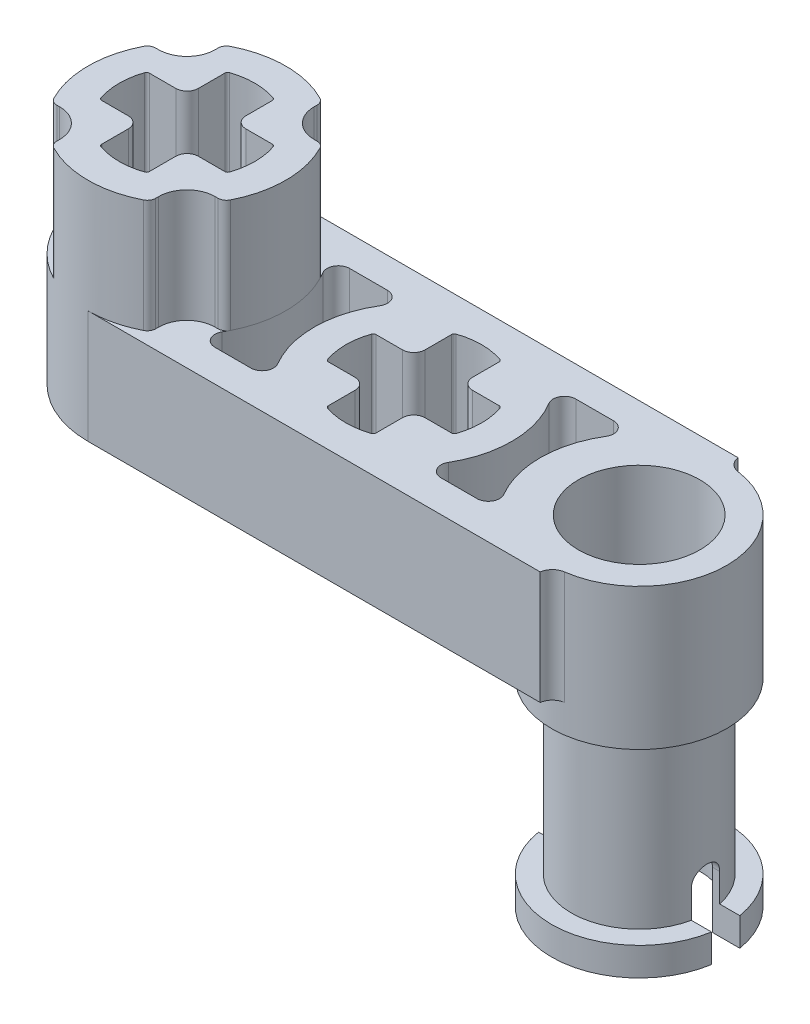
from build123d import *
from build123d.topology import SkipClean

# Parameters (mm, degrees)
BOSS_EXTRUDE1_DEPTH     = 2
BOSS_EXTRUDE3_START     = 4
BOSS_EXTRUDE3_DEPTH     = 4
CUT_EXTRUDE1_DEPTH      = 22.365860619
SKETCH8_R               = 2.15
CUT_EXTRUDE3_DEPTH      = 4
SKETCH10_R              = 3.1
BOSS_EXTRUDE4_DEPTH     = 1
SKETCH12_R              = 2.4
BOSS_EXTRUDE5_DEPTH     = 7
SKETCH15_R              = 3.1
BOSS_EXTRUDE6_DEPTH     = 1
SKETCH16_R              = 2.15
CUT_EXTRUDE4_DEPTH      = 22.365860619
CUT_EXTRUDE5_DEPTH      = 23.192341021
CUT_EXTRUDE5_DEPTH_BACK = 23.192341021
LPATTERN3_COUNT         = 2
LPATTERN3_PITCH         = 8.02
CUT_EXTRUDE6_DEPTH      = 24.162469696
LPATTERN4_COUNT         = 2
LPATTERN4_PITCH         = 8
CUT_EXTRUDE7_DEPTH      = 24.162469696
FILLET2_R               = 0.5
FILLET3_R               = 0.5


with BuildPart() as part:
    # Sketch2 → Boss-Extrude1 (new, symmetric)
    with BuildSketch(Plane(origin=(0, 0, 0), x_dir=(1, 0, 0), z_dir=(0, 1, 0))):
        with BuildLine():
            Line((0, 3.5), (16, 3.5))
            ThreePointArc((16, 3.5), (19.5, 0), (16, -3.5))
            Line((16, -3.5), (0, -3.5))
            ThreePointArc((0, -3.5), (-3.5, 0), (0, 3.5))
        make_face()
    extrude(amount=BOSS_EXTRUDE1_DEPTH, both=True)

    # Sketch3 → Boss-Extrude3 (add)
    with SkipClean():  # the faces are left unmerged after this step: merging them gives an invalid solid
        with BuildSketch(Plane(origin=(0, 2, 0), x_dir=(1, 0, 0), z_dir=(0, 1, 0)).offset(BOSS_EXTRUDE3_START)):
            with BuildLine():
                Line((1.75, 2.75), (1.75, 2.852630365))
                ThreePointArc((1.75, 2.852630365), (1.705715907, 3.00950412), (1.5859375, 3.120064462))
                ThreePointArc((1.5859375, 3.120064462), (0, 3.5), (-1.5859375, 3.120064462))
                ThreePointArc((-1.5859375, 3.120064462), (-1.705715907, 3.00950412), (-1.75, 2.852630365))
                Line((-1.75, 2.852630365), (-1.75, 2.75))
                ThreePointArc((-1.75, 2.75), (-2.042893219, 2.042893219), (-2.75, 1.75))
                Line((-2.75, 1.75), (-2.852630365, 1.75))
                ThreePointArc((-2.852630365, 1.75), (-3.00950412, 1.705715907), (-3.120064462, 1.5859375))
                ThreePointArc((-3.120064462, 1.5859375), (-3.5, 0), (-3.120064462, -1.5859375))
                ThreePointArc((-3.120064462, -1.5859375), (-3.00950412, -1.705715907), (-2.852630365, -1.75))
                Line((-2.852630365, -1.75), (-2.75, -1.75))
                ThreePointArc((-2.75, -1.75), (-2.042893219, -2.042893219), (-1.75, -2.75))
                Line((-1.75, -2.75), (-1.75, -2.852630365))
                ThreePointArc((-1.75, -2.852630365), (-1.705715907, -3.00950412), (-1.5859375, -3.120064462))
                ThreePointArc((-1.5859375, -3.120064462), (0, -3.5), (1.5859375, -3.120064462))
                ThreePointArc((1.5859375, -3.120064462), (1.705715907, -3.00950412), (1.75, -2.852630365))
                Line((1.75, -2.852630365), (1.75, -2.75))
                ThreePointArc((1.75, -2.75), (2.042893219, -2.042893219), (2.75, -1.75))
                Line((2.75, -1.75), (2.852630365, -1.75))
                ThreePointArc((2.852630365, -1.75), (3.00950412, -1.705715907), (3.120064462, -1.5859375))
                ThreePointArc((3.120064462, -1.5859375), (3.5, 0), (3.120064462, 1.5859375))
                ThreePointArc((3.120064462, 1.5859375), (3.00950412, 1.705715907), (2.852630365, 1.75))
                Line((2.852630365, 1.75), (2.75, 1.75))
                ThreePointArc((2.75, 1.75), (2.042893219, 2.042893219), (1.75, 2.75))
            make_face()
        extrude(amount=-BOSS_EXTRUDE3_DEPTH)

    # Sketch4 → Cut-Extrude1 (cut, through all)
    with SkipClean():  # the faces are left unmerged after this step: merging them gives an invalid solid
        with BuildSketch(Plane(origin=(0, 6, 0), x_dir=(1, 0, 0), z_dir=(0, 1, 0))):
            with BuildLine():
                Line((-0.861545414, -1.212506528), (-0.861545414, -2.150211742))
                ThreePointArc((-0.861545414, -2.150211742), (-0.842839298, -2.208446649), (-0.793719327, -2.244894577))
                ThreePointArc((-0.793719327, -2.244894577), (-0.021545414, -2.372506528), (0.750628499, -2.244894577))
                ThreePointArc((0.750628499, -2.244894577), (0.799748471, -2.208446649), (0.818454586, -2.150211742))
                Line((0.818454586, -2.150211742), (0.818454586, -1.212506528))
                ThreePointArc((0.818454586, -1.212506528), (0.935611874, -0.929663815), (1.218454586, -0.812506528))
                Line((1.218454586, -0.812506528), (2.156159801, -0.812506528))
                ThreePointArc((2.156159801, -0.812506528), (2.214394707, -0.793800412), (2.250842636, -0.744680441))
                ThreePointArc((2.250842636, -0.744680441), (2.378454586, 0.027493472), (2.250842636, 0.799667385))
                ThreePointArc((2.250842636, 0.799667385), (2.214394707, 0.848787357), (2.156159801, 0.867493472))
                Line((2.156159801, 0.867493472), (1.218454586, 0.867493472))
                ThreePointArc((1.218454586, 0.867493472), (0.935611874, 0.98465076), (0.818454586, 1.267493472))
                Line((0.818454586, 1.267493472), (0.818454586, 2.205198686))
                ThreePointArc((0.818454586, 2.205198686), (0.799748471, 2.263433593), (0.750628499, 2.299881522))
                ThreePointArc((0.750628499, 2.299881522), (-0.021545414, 2.427493472), (-0.793719327, 2.299881522))
                ThreePointArc((-0.793719327, 2.299881522), (-0.842839298, 2.263433593), (-0.861545414, 2.205198686))
                Line((-0.861545414, 2.205198686), (-0.861545414, 1.267493472))
                ThreePointArc((-0.861545414, 1.267493472), (-0.978702701, 0.98465076), (-1.261545414, 0.867493472))
                Line((-1.261545414, 0.867493472), (-2.199250628, 0.867493472))
                ThreePointArc((-2.199250628, 0.867493472), (-2.257485535, 0.848787357), (-2.293933463, 0.799667385))
                ThreePointArc((-2.293933463, 0.799667385), (-2.421545414, 0.027493472), (-2.293933463, -0.744680441))
                ThreePointArc((-2.293933463, -0.744680441), (-2.257485535, -0.793800412), (-2.199250628, -0.812506528))
                Line((-2.199250628, -0.812506528), (-1.261545414, -0.812506528))
                ThreePointArc((-1.261545414, -0.812506528), (-0.978702701, -0.929663815), (-0.861545414, -1.212506528))
            make_face()
        cut_extrude1 = extrude(amount=-CUT_EXTRUDE1_DEPTH, mode=Mode.SUBTRACT)

    # Sketch8 → Cut-Extrude3 (cut)
    with SkipClean():  # the faces are left unmerged after this step: merging them gives an invalid solid
        with BuildSketch(Plane(origin=(0, 2, 0), x_dir=(1, 0, 0), z_dir=(0, 1, 0))):
            with Locations(Location((16, 0, 0), (0, 0, 270))):
                Circle(SKETCH8_R)
        extrude(amount=-CUT_EXTRUDE3_DEPTH, mode=Mode.SUBTRACT)

    # Sketch10 → Boss-Extrude4 (add)
    with SkipClean():  # the faces are left unmerged after this step: merging them gives an invalid solid
        with BuildSketch(Plane(origin=(0, -2, 0), x_dir=(-1, 0, 0), z_dir=(0, -1, 0))):
            with Locations(Location((-16, 0, 0), (0, 0, 270))):
                Circle(SKETCH10_R)
        extrude(amount=BOSS_EXTRUDE4_DEPTH)

    # Sketch12 → Boss-Extrude5 (add)
    with SkipClean():  # the faces are left unmerged after this step: merging them gives an invalid solid
        with BuildSketch(Plane(origin=(0, -2, 0), x_dir=(-1, 0, 0), z_dir=(0, -1, 0))):
            with Locations(Location((-16, 0, 0), (0, 0, 90))):
                Circle(SKETCH12_R)
        extrude(amount=BOSS_EXTRUDE5_DEPTH)

    # Sketch15 → Boss-Extrude6 (add)
    with SkipClean():  # the faces are left unmerged after this step: merging them gives an invalid solid
        with BuildSketch(Plane(origin=(0, -9, 0), x_dir=(-1, 0, 0), z_dir=(0, -1, 0))):
            with Locations(Location((-16, 0, 0), (0, 0, 270))):
                Circle(SKETCH15_R)
        extrude(amount=BOSS_EXTRUDE6_DEPTH)

    # Sketch16 → Cut-Extrude4 (cut, through all)
    with SkipClean():  # the faces are left unmerged after this step: merging them gives an invalid solid
        with BuildSketch(Plane(origin=(0, -2, 0), x_dir=(1, 0, 0), z_dir=(0, 1, 0))):
            with Locations(Location((16, 0, 0), (0, 0, 270))):
                Circle(SKETCH16_R)
        extrude(amount=-CUT_EXTRUDE4_DEPTH, mode=Mode.SUBTRACT)

    # Sketch17 → Cut-Extrude5 (cut, two sides: drawn at the far end of the back side and taken through both)
    with SkipClean():  # the faces are left unmerged after this step: merging them gives an invalid solid
        with BuildSketch(Plane(origin=(0, 0, 0), x_dir=(0, 0, -1), z_dir=(1, 0, 0)).offset(-CUT_EXTRUDE5_DEPTH_BACK)):
            with BuildLine():
                Line((-0.5, -10), (-0.5, -8))
                ThreePointArc((-0.5, -8), (0, -7.5), (0.5, -8))
                Line((0.5, -8), (0.5, -10))
                ThreePointArc((0.5, -10), (0, -10.5), (-0.5, -10))
            make_face()
        extrude(amount=CUT_EXTRUDE5_DEPTH + CUT_EXTRUDE5_DEPTH_BACK, mode=Mode.SUBTRACT)

    # LPattern3: Cut-Extrude1 ×2
    with SkipClean():  # the faces are left unmerged after this step: merging them gives an invalid solid
        with Locations(*[(i * LPATTERN3_PITCH, 0, 0) for i in range(1, LPATTERN3_COUNT)]):
            add(cut_extrude1, mode=Mode.SUBTRACT)

    # Sketch20 → Cut-Extrude6 (cut, through all)
    with SkipClean():  # the faces are left unmerged after this step: merging them gives an invalid solid
        with BuildSketch(Plane(origin=(0, 2, 0), x_dir=(1, 0, 0), z_dir=(0, 1, 0))):
            with BuildLine():
                Line((11.330011313, 2.427493472), (12.668443274, 2.427493472))
                ThreePointArc((12.668443274, 2.427493472), (13.017140291, 2.223479161), (13.010141399, 1.819545424))
                ThreePointArc((13.010141399, 1.819545424), (12.500118007, 0.028740879), (12.98066258, -1.770198166))
                ThreePointArc((12.98066258, -1.770198166), (12.982671335, -2.171348997), (12.635595447, -2.372506528))
                Line((12.635595447, -2.372506528), (11.362859139, -2.372506528))
                ThreePointArc((11.362859139, -2.372506528), (11.015783251, -2.171348997), (11.017792006, -1.770198166))
                ThreePointArc((11.017792006, -1.770198166), (11.498336579, 0.028740879), (10.988313187, 1.819545424))
                ThreePointArc((10.988313187, 1.819545424), (10.981314296, 2.223479161), (11.330011313, 2.427493472))
            make_face()
        cut_extrude6 = extrude(amount=-CUT_EXTRUDE6_DEPTH, mode=Mode.SUBTRACT)

    # LPattern4: Cut-Extrude6 ×2
    with Locations(*[(-i * LPATTERN4_PITCH, 0, 0) for i in range(1, LPATTERN4_COUNT)]):
        add(cut_extrude6, mode=Mode.SUBTRACT)

    # Sketch25 → Cut-Extrude7 (cut, through all)
    with BuildSketch(Plane(origin=(0, 2, 0), x_dir=(1, 0, 0), z_dir=(0, 1, 0))):
        with BuildLine():
            Line((16, 3.5), (16, 3.1))
            ThreePointArc((16, 3.1), (19.1, 0), (16, -3.1))
            Line((16, -3.1), (16, -3.5))
            ThreePointArc((16, -3.5), (19.5, 0), (16, 3.5))
        make_face()
    extrude(amount=-CUT_EXTRUDE7_DEPTH, mode=Mode.SUBTRACT)

    # Fillet2
    # the kernel refuses this fillet: 0.5 mm, written as the material it adds along each edge
    with BuildSketch(Plane(origin=(16, 2, 3.1), x_dir=(0.9976162063830436, 0, -0.06900655593423367), z_dir=(0, -1, 0))) as fillet2_piece_1:
        with BuildLine():
            CenterArc((0.462343925, 0.498808103), FILLET2_R, 191.509080872, 74.533990047)
            Line((-0.027602622, 0.399046483), (-0.037401553, 0.39705125))
            ThreePointArc((-0.037401553, 0.39705125), (-0.023777473, 0.198833176), (-0.009976162, -0.000690066))
            Line((-0.009976162, -0.000690066), (0.000690066, -0.009976162))
            ThreePointArc((0.000690066, -0.009976162), (0.213920323, -0.00261024), (0.427150581, -0.009976162))
            Line((0.427150581, -0.009976162), (0.427840647, 0))
        make_face()
    extrude(amount=4)

    # Fillet3
    # the kernel refuses this fillet: 0.5 mm, written as the material it adds along each edge
    with BuildSketch(Plane(origin=(16, 2, -3.1), x_dir=(0, 0, -1), z_dir=(0, -1, 0))) as fillet3_piece_1:
        with BuildLine():
            CenterArc((0.465714286, 0.495662822), FILLET3_R, 187.913858162, 74.533990047)
            Line((-0.02952381, 0.426820763), (-0.039428571, 0.425443922))
            ThreePointArc((-0.039428571, 0.425443922), (-0.017365922, 0.213230258), (-0.01, 0))
            Line((-0.01, 0), (0, -0.01))
            ThreePointArc((0, -0.01), (0.2, -0.01), (0.398685714, -0.009913256))
            Line((0.398685714, -0.009913256), (0.4, 0))
        make_face()
    extrude(amount=4)


solid = part.part
